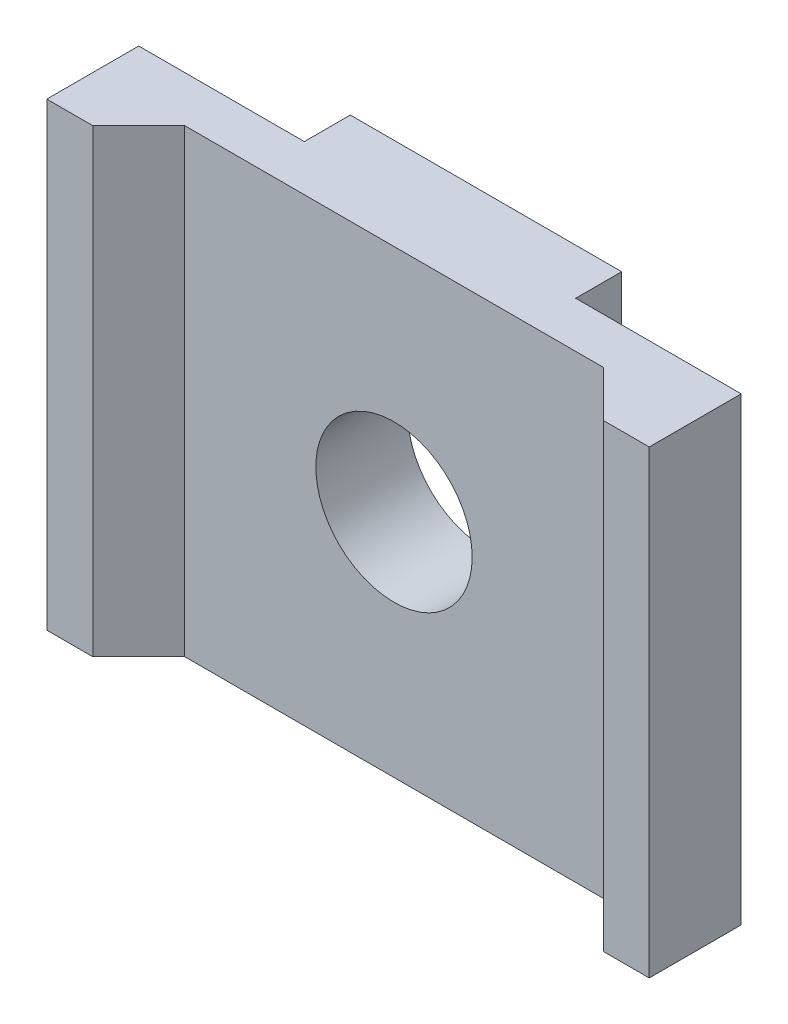
from build123d import *

# Parameters (mm, degrees)
AUFSATZ_LINEAR_AUSTRAGEN1_DEPTH = 10
DURCHGANGSLOCH_F_R_M31_D        = 3.4
FORMSCHR_GE1_ANGLE              = 45


with BuildPart() as part:
    # Skizze1 → Aufsatz-Linear austragen1 (new body)
    with BuildSketch(Plane(origin=(0, 0, 0), x_dir=(1, 0, 0), z_dir=(0, 1, 0))):
        Polygon((0, 0), (-4.55, 0), (-4.55, -1), (-6.55, -1), (-6.55, 1), (-2.95, 1), (-2.95, 2), (0, 2), align=None)
    extrude(amount=AUFSATZ_LINEAR_AUSTRAGEN1_DEPTH)

    # Spiegeln1: part across plane


with BuildPart() as part_1:
    add(part.part)
    add(part.part.mirror(Plane(origin=(0, 10, -2), x_dir=(0, 0, 1), z_dir=(-1, 0, 0))))

    # Durchgangsloch für M31 (through all)
    with Locations(Plane.XY):
        with Locations((0, 5)):
            Hole(DURCHGANGSLOCH_F_R_M31_D / 2)

    # Formschräge1
    formschr_ge1_faces = [part_1.faces().sort_by_distance(p)[0] for p in [
        (4.55, 5, 0.5),
        (-4.55, 5, 0.5),
    ]]
    draft(formschr_ge1_faces, Plane(origin=(0, 10, 0), x_dir=(1, 0, 0), z_dir=(0, 0, 1)), FORMSCHR_GE1_ANGLE)


solid = part_1.part
